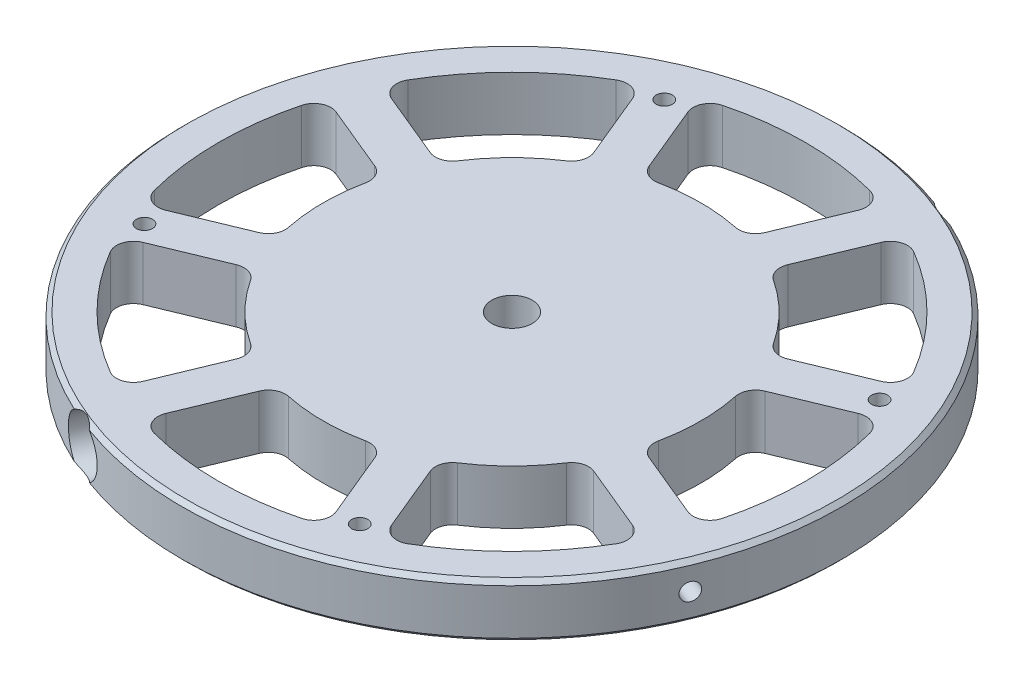
from build123d import *

# Parameters (mm, degrees)
SKETCH2_W                = 77.55
SKETCH2_H                = 12.7
F_10_24_TAPPED_HOLE2_D   = 3.7973
CIRPATTERN3_COUNT        = 4
CUT_EXTRUDE1_DEPTH       = 111.405140279
FILLET1_R                = 4
CIRPATTERN4_COUNT        = 8
FILLET1_OF_CIRPATTERN4_R = 4
CHAMFER1_SIZE            = 1
SKETCH15_W               = 2.0447
SKETCH15_H               = 101.323957926
SKETCH19_R               = 6.25
CUT_EXTRUDE3_DEPTH       = 5
CIRPATTERN5_COUNT        = 2
CIRPATTERN6_COUNT        = 2
SKETCH22_R               = 4.765
CUT_EXTRUDE4_DEPTH       = 12.8


with BuildPart() as part:
    # Sketch2 → Revolve1 (revolve)
    with BuildSketch(Plane(origin=(0, 0, 0), x_dir=(0, 0, -1), z_dir=(1, 0, 0))):
        with Locations((-38.775, 6.35)):
            Rectangle(SKETCH2_W, SKETCH2_H)
    revolve(axis=Axis((0, -0.635, 0), (0, 1, 0)))

    # #10-24 Tapped Hole2 (through all)
    with Locations(Plane(origin=(0, 12.7, 0), x_dir=(1, 0, 0), z_dir=(0, 1, 0))):
        with Locations((-25.333643223, 61.160825052)):
            f_10_24_tapped_hole2 = Hole(F_10_24_TAPPED_HOLE2_D / 2)

    # CirPattern3: #10-24 Tapped Hole2 ×4 about axis
    cirpattern3_axis = Axis((0, -0.635, 0), (0, 1, 0))
    for i in range(1, CIRPATTERN3_COUNT):
        add(f_10_24_tapped_hole2.rotate(cirpattern3_axis, i * 360 / CIRPATTERN3_COUNT), mode=Mode.SUBTRACT)

    # Sketch8 → Cut-Extrude1 (cut, through all)
    with BuildSketch(Plane(origin=(0, 12.7, 0), x_dir=(1, 0, 0), z_dir=(0, 1, 0))):
        with BuildLine():
            Line((-12.282922052, 42.719226653), (-21.735525784, 65.539830782))
            ThreePointArc((-21.735525784, 65.539830782), (0, 69.05), (21.735525784, 65.539830782))
            Line((21.735525784, 65.539830782), (12.282922052, 42.719226653))
            ThreePointArc((12.282922052, 42.719226653), (0, 44.45), (-12.282922052, 42.719226653))
        make_face()
    cut_extrude1 = extrude(amount=-CUT_EXTRUDE1_DEPTH, mode=Mode.SUBTRACT)

    # Fillet1
    fillet1_edges = [part.edges().sort_by_distance(p)[0] for p in [
        (12.282922052, 6.35, -42.719226653),
        (21.735525784, 6.35, -65.539830782),
        (-12.282922052, 6.35, -42.719226653),
        (-21.735525784, 6.35, -65.539830782),
    ]]
    fillet(fillet1_edges, radius=FILLET1_R)

    # CirPattern4: Cut-Extrude1 ×8 about axis
    cirpattern4_axis = Axis((0, -0.635, 0), (0, 1, 0))
    for i in range(1, CIRPATTERN4_COUNT):
        add(cut_extrude1.rotate(cirpattern4_axis, i * 360 / CIRPATTERN4_COUNT), mode=Mode.SUBTRACT)

    # Fillet1 of CirPattern4
    fillet1_of_cirpattern4_edges = [part.edges().sort_by_distance(p)[0] for p in [
        (-21.521717378, 6.35, -38.89239233),
        (-30.974321109, 6.35, -61.712996458),
        (-38.89239233, 6.35, -21.521717378),
        (-61.712996458, 6.35, -30.974321109),
        (-42.719226653, 6.35, -12.282922052),
        (-65.539830782, 6.35, -21.735525784),
        (-42.719226653, 6.35, 12.282922052),
        (-65.539830782, 6.35, 21.735525784),
        (-38.89239233, 6.35, 21.521717378),
        (-61.712996458, 6.35, 30.974321109),
        (-21.521717378, 6.35, 38.89239233),
        (-30.974321109, 6.35, 61.712996458),
        (-12.282922052, 6.35, 42.719226653),
        (-21.735525784, 6.35, 65.539830782),
        (12.282922052, 6.35, 42.719226653),
        (21.735525784, 6.35, 65.539830782),
        (21.521717378, 6.35, 38.89239233),
        (30.974321109, 6.35, 61.712996458),
        (38.89239233, 6.35, 21.521717378),
        (61.712996458, 6.35, 30.974321109),
        (42.719226653, 6.35, 12.282922052),
        (65.539830782, 6.35, 21.735525784),
        (42.719226653, 6.35, -12.282922052),
        (65.539830782, 6.35, -21.735525784),
        (38.89239233, 6.35, -21.521717378),
        (61.712996458, 6.35, -30.974321109),
        (21.521717378, 6.35, -38.89239233),
        (30.974321109, 6.35, -61.712996458),
    ]]
    fillet(fillet1_of_cirpattern4_edges, radius=FILLET1_OF_CIRPATTERN4_R)

    # Chamfer1
    chamfer1_edges = [part.edges().sort_by_distance(p)[0] for p in [
        (0, 0, -77.55),
        (0, 12.7, -77.55),
    ]]
    chamfer(chamfer1_edges, length=CHAMFER1_SIZE)

    # Sketch15 → #20 (0.161) Diameter Hole1 (revolve, cut)
    with BuildSketch(Plane(origin=(0, 6.35, 0), x_dir=(-0.38268343236508734, 0, 0.9238795325112877), z_dir=(0, 1, 0))):
        with Locations((1.02235, 50.661978963)):
            Rectangle(SKETCH15_W, SKETCH15_H)
    revolve(axis=Axis((-5.866635031, 6.35, -2.430039796), (0.9238795325112877, 0, 0.3826834323650874)), mode=Mode.SUBTRACT)

    # Sketch19 → Cut-Extrude3 (cut)
    with BuildSketch(Plane(origin=(29.67710018, 0, -71.646857746), x_dir=(-0.9238795325112891, 0, -0.38268343236508423), z_dir=(0.38268343236508423, 0, -0.9238795325112891))):
        with Locations((0, 6.35)):
            Circle(SKETCH19_R)
    cut_extrude3 = extrude(amount=-CUT_EXTRUDE3_DEPTH, mode=Mode.SUBTRACT)

    # CirPattern5: Cut-Extrude3 ×2 about axis
    cirpattern5_axis = Axis((0, -0.635, 0), (0, 1, 0))
    for i in range(1, CIRPATTERN5_COUNT):
        add(cut_extrude3.rotate(cirpattern5_axis, i * 360 / CIRPATTERN5_COUNT), mode=Mode.SUBTRACT)

    # Sketch21 → #10-24 Tapped Hole1 (revolve, cut)
    with BuildSketch(Plane(origin=(-27.763683018, 6.35, 67.027460084), x_dir=(0.9238795325112891, 0, 0.38268343236508423), z_dir=(0, 1, 0))):
        Polygon((0, 0), (0, 51.940824014), (1.89865, 50.8), (1.89865, 0), align=None)
    f_10_24_tapped_hole1 = revolve(axis=Axis((-30.193722814, 6.35, 72.894095115), (0.38268343236508423, 0, -0.923879532511289)), mode=Mode.SUBTRACT)

    # CirPattern6: #10-24 Tapped Hole1 ×2 about axis
    cirpattern6_axis = Axis((0, -0.635, 0), (0, 1, 0))
    for i in range(1, CIRPATTERN6_COUNT):
        add(f_10_24_tapped_hole1.rotate(cirpattern6_axis, i * 360 / CIRPATTERN6_COUNT), mode=Mode.SUBTRACT)

    # Sketch22 → Cut-Extrude4 (cut)
    with BuildSketch(Plane(origin=(0, 12.7, 0), x_dir=(1, 0, 0), z_dir=(0, 1, 0))):
        Circle(SKETCH22_R)
    extrude(amount=-CUT_EXTRUDE4_DEPTH, mode=Mode.SUBTRACT)


solid = part.part
